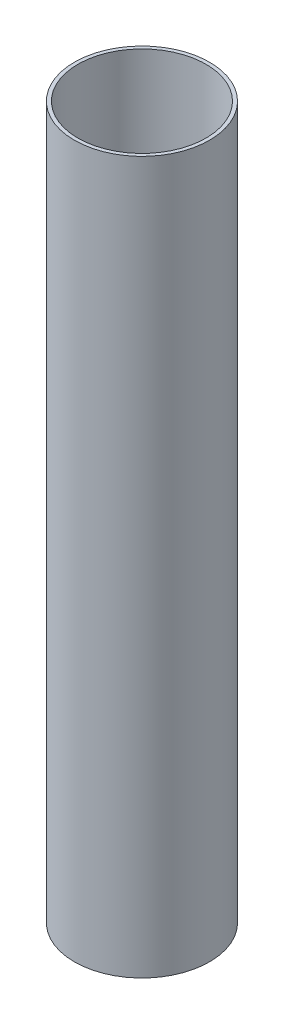
from build123d import *

# Parameters (mm, degrees)
SKETCH2_R                      = 38
SKETCH2_R_2                    = 36
BOSS_EXTRUDE1_DEPTH            = 400
CUT_EXTRUDE1_REACH             = 405.594
CUT_EXTRUDE1_DIRECTION_2_REACH = 405.594


with BuildPart() as part:
    # Sketch2 → Boss-Extrude1 (new body)
    with BuildSketch(Plane(origin=(0, 0, 0), x_dir=(1, 0, 0), z_dir=(0, 1, 0))):
        Circle(SKETCH2_R)
        Circle(SKETCH2_R_2, mode=Mode.SUBTRACT)
    extrude(amount=BOSS_EXTRUDE1_DEPTH)

    # Sketch3 → Cut-Extrude1 (cut, up to next)
    with BuildSketch(Plane(origin=(0, 0, 0), x_dir=(-1, 0, 0), z_dir=(0, 0.20449605184179045, 0.978867388761685)), mode=Mode.PRIVATE) as cut_extrude1_sk1:
        with BuildLine():
            ThreePointArc((8.5, -185), (0, -176.5), (-8.5, -185))
            add(Edge.make_bspline(
                [(-8.5, -185), (-8.5, -202), (0, -202), (8.5, -202), (8.5, -185)],
                knots=[4.71238898, 4.71238898, 4.71238898, 6.283185307, 6.283185307, 7.853981634, 7.853981634, 7.853981634], degree=2, weights=[1, 0.707106781, 1, 0.707106781, 1]))
        make_face()
    cut_extrude1_tool1 = extrude(cut_extrude1_sk1.sketch, amount=CUT_EXTRUDE1_REACH, mode=Mode.PRIVATE) & part.part
    add(cut_extrude1_tool1.solids().sort_by_distance((0, 184.620477, -38.569227))[0], mode=Mode.SUBTRACT)

    # Sketch3 → Cut-Extrude1 direction 2 (cut, up to next)
    with BuildSketch(Plane(origin=(0, 0, 0), x_dir=(-1, 0, 0), z_dir=(0, 0.20449605184179045, 0.978867388761685)), mode=Mode.PRIVATE) as cut_extrude1_direction_2_sk1:
        with BuildLine():
            ThreePointArc((8.5, -185), (0, -176.5), (-8.5, -185))
            add(Edge.make_bspline(
                [(-8.5, -185), (-8.5, -202), (0, -202), (8.5, -202), (8.5, -185)],
                knots=[4.71238898, 4.71238898, 4.71238898, 6.283185307, 6.283185307, 7.853981634, 7.853981634, 7.853981634], degree=2, weights=[1, 0.707106781, 1, 0.707106781, 1]))
        make_face()
    cut_extrude1_direction_2_tool1 = extrude(cut_extrude1_direction_2_sk1.sketch, amount=-CUT_EXTRUDE1_DIRECTION_2_REACH, mode=Mode.PRIVATE) & part.part
    add(cut_extrude1_direction_2_tool1.solids().sort_by_distance((0, 184.620477, -38.569227))[0], mode=Mode.SUBTRACT)


solid = part.part
